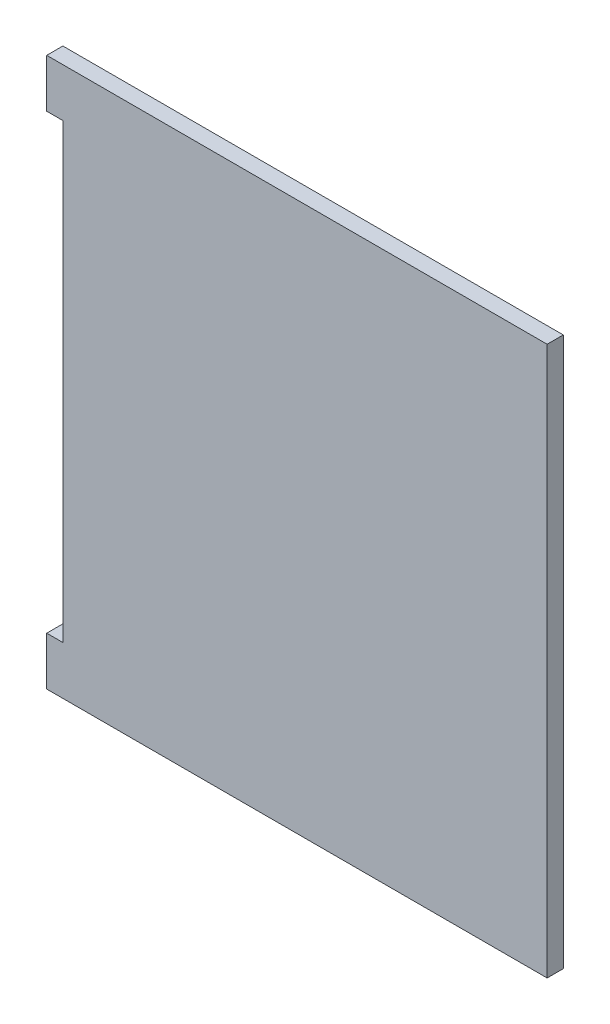
from build123d import *

# Parameters (mm, degrees)
SKETCH1_W           = 196.85
SKETCH1_H           = 215.9
BOSS_EXTRUDE1_DEPTH = 6.35
SKETCH2_W           = 6.35
SKETCH2_H           = 177.8
CUT_EXTRUDE1_DEPTH  = 293.238010875


with BuildPart() as part:
    # Sketch1 → Boss-Extrude1 (new body)
    with BuildSketch(Plane.XY):
        with Locations((98.425, -107.95)):
            Rectangle(SKETCH1_W, SKETCH1_H)
    extrude(amount=BOSS_EXTRUDE1_DEPTH)

    # Sketch2 → Cut-Extrude1 (cut, through all)
    with BuildSketch(Plane(origin=(0, 0, 0), x_dir=(-1, 0, 0), z_dir=(0, 0, -1))):
        with Locations((-3.175, -107.95)):
            Rectangle(SKETCH2_W, SKETCH2_H)
    extrude(amount=-CUT_EXTRUDE1_DEPTH, mode=Mode.SUBTRACT)


solid = part.part
